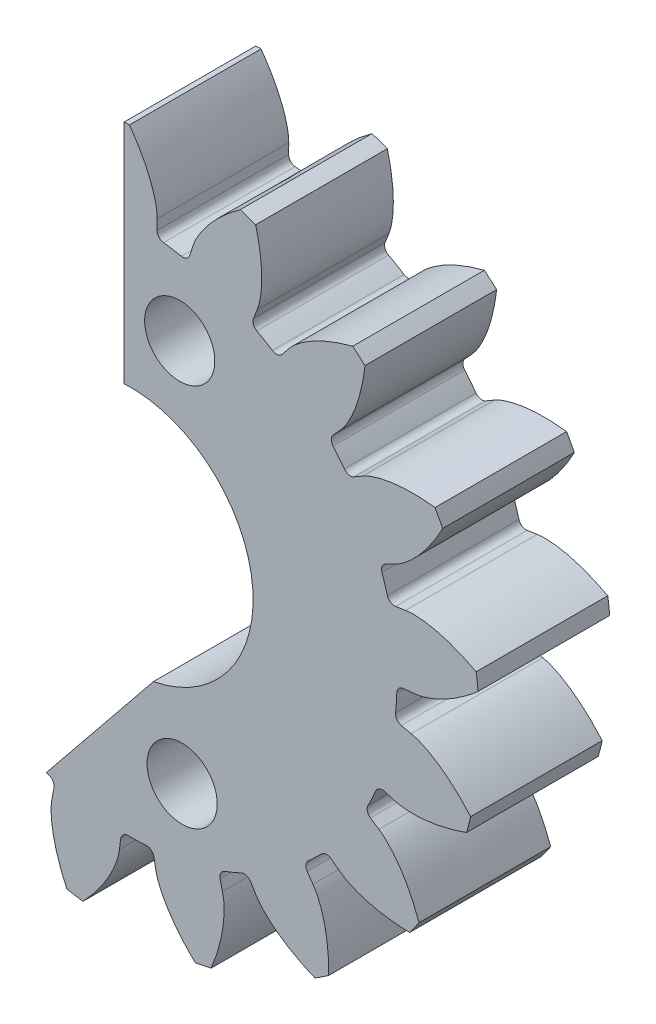
from build123d import *

# Parameters (mm, degrees)
SKETCH1_R                                           = 1.5
BOSS_EXTRUDE1_DEPTH                                 = 4.5
CUT_EXTRUDE1_DEPTH                                  = 18.474286306
CSK_FOR_M2_COUNTERSUNK_FLAT_HEAD_SCREW1_D           = 2.4
CSK_FOR_M2_COUNTERSUNK_FLAT_HEAD_SCREW1_DEPTH       = 10
CSK_FOR_M2_COUNTERSUNK_FLAT_HEAD_SCREW1_CSINK_D     = 4.4
CSK_FOR_M2_COUNTERSUNK_FLAT_HEAD_SCREW1_CSINK_ANGLE = 90
CSK_FOR_M2_COUNTERSUNK_FLAT_HEAD_SCREW1_TIP         = 0.721032743


with BuildPart() as part:
    # Sketch1 → Boss-Extrude1 (new body)
    with BuildSketch(Plane.XY):
        with BuildLine():
            Line((2.142690816, 9.446385822), (2.036760212, 9.116523343))
            ThreePointArc((2.036760212, 9.116523343), (1.925215556, 8.976884922), (1.749077663, 8.946610489))
            ThreePointArc((1.749077663, 8.946610489), (1.443445404, 9.000976463), (1.136139278, 9.044904613))
            ThreePointArc((1.136139278, 9.044904613), (0.978300237, 9.128737399), (0.916012393, 9.296252542))
            Line((0.916012393, 9.296252542), (0.918538131, 9.642697586))
            add(Edge.make_bspline(
                [(0.918538131, 9.642697586), (0.920074647, 9.853455045), (0.756738592, 10.686258414), (0.336577813, 11.434986659), (-0.030409782, 11.94504001)],
                knots=[0, 0, 0, 0, 0.250058326, 1, 1, 1, 1], degree=3))
            ThreePointArc((-0.030409782, 11.94504001), (-0.308005832, 11.941107068), (-0.585435504, 11.93072382))
            add(Edge.make_bspline(
                [(-0.585435504, 11.93072382), (-0.924729077, 11.407724954), (-1.308534817, 10.639195503), (-1.429406641, 9.798416791), (-1.414428472, 9.582521648)],
                knots=[-0.008484668, -0.008484668, -0.008484668, -0.008484668, 0.741457006, 1, 1, 1, 1], degree=3))
            Line((-1.414428472, 9.582521648), (-1.394045746, 9.236667499))
            ThreePointArc((-1.394045746, 9.236667499), (-1.447614825, 9.066163972), (-1.600922132, 8.974305558))
            ThreePointArc((-1.600922132, 8.974305558), (-1.905554981, 8.914593212), (-2.207978087, 8.844543215))
            ThreePointArc((-2.207978087, 8.844543215), (-2.385442505, 8.865696922), (-2.50403764, 8.999399176))
            Line((-2.50403764, 8.999399176), (-2.626832843, 9.32336196))
            add(Edge.make_bspline(
                [(-2.626832843, 9.32336196), (-2.701534461, 9.520442492), (-3.154684073, 10.238004717), (-3.81694417, 10.784393433), (-4.343402434, 11.127432808)],
                knots=[0, 0, 0, 0, 0.250058326, 1, 1, 1, 1], degree=3))
            ThreePointArc((-4.343402434, 11.127432808), (-4.600832298, 11.023486189), (-4.855776901, 10.913584942))
            add(Edge.make_bspline(
                [(-4.855776901, 10.913584942), (-4.983229754, 10.303336047), (-5.063493088, 9.448057053), (-4.872478404, 8.620390313), (-4.780521357, 8.424484826)],
                knots=[-0.008484668, -0.008484668, -0.008484668, -0.008484668, 0.741457006, 1, 1, 1, 1], degree=3))
            Line((-4.780521357, 8.424484826), (-4.636578102, 8.109348527))
            ThreePointArc((-4.636578102, 8.109348527), (-4.624936802, 7.93100734), (-4.734708522, 7.789970933))
            ThreePointArc((-4.734708522, 7.789970933), (-4.997199607, 7.62424475), (-5.253895777, 7.449677247))
            ThreePointArc((-5.253895777, 7.449677247), (-5.427018018, 7.405294949), (-5.585903513, 7.487127083))
            Line((-5.585903513, 7.487127083), (-5.817435487, 7.74485464))
            add(Edge.make_bspline(
                [(-5.817435487, 7.74485464), (-5.95828637, 7.901641426), (-6.640049173, 8.407051753), (-7.454966693, 8.677308116), (-8.069794519, 8.807004146)],
                knots=[0, 0, 0, 0, 0.250058326, 1, 1, 1, 1], degree=3))
            ThreePointArc((-8.069794519, 8.807004146), (-8.272290869, 8.617082417), (-8.470318721, 8.422505943))
            add(Edge.make_bspline(
                [(-8.470318721, 8.422505943), (-8.368717639, 7.807424515), (-8.13459856, 6.980906144), (-7.65749496, 6.278132356), (-7.500978342, 6.128674647)],
                knots=[-0.008484668, -0.008484668, -0.008484668, -0.008484668, 0.741457006, 1, 1, 1, 1], degree=3))
            Line((-7.500978342, 6.128674647), (-7.252914893, 5.886817101))
            ThreePointArc((-7.252914893, 5.886817101), (-7.177635437, 5.724724219), (-7.22904629, 5.553557567))
            ThreePointArc((-7.22904629, 5.553557567), (-7.413944735, 5.304199787), (-7.59024573, 5.048691086))
            ThreePointArc((-7.59024573, 5.048691086), (-7.735644677, 4.944766859), (-7.913362165, 4.963676991))
            Line((-7.913362165, 4.963676991), (-8.222361232, 5.120361784))
            add(Edge.make_bspline(
                [(-8.222361232, 5.120361784), (-8.410338689, 5.2156799), (-9.228638839, 5.440679864), (-10.086154654, 5.398304255), (-10.706316137, 5.297140773)],
                knots=[0, 0, 0, 0, 0.250058326, 1, 1, 1, 1], degree=3))
            ThreePointArc((-10.706316137, 5.297140773), (-10.826530719, 5.046893916), (-10.940897062, 4.793920846))
            add(Edge.make_bspline(
                [(-10.940897062, 4.793920846), (-10.623963835, 4.25707704), (-10.107081422, 3.570945177), (-9.40832439, 3.087977836), (-9.208386639, 3.005152997)],
                knots=[-0.008484668, -0.008484668, -0.008484668, -0.008484668, 0.741457006, 1, 1, 1, 1], degree=3))
            Line((-9.208386639, 3.005152997), (-8.889705338, 2.869238405))
            ThreePointArc((-8.889705338, 2.869238405), (-8.760954633, 2.745285371), (-8.7470613, 2.567105479))
            ThreePointArc((-8.7470613, 2.567105479), (-8.829395545, 2.267793252), (-8.901490937, 1.965851218))
            ThreePointArc((-8.901490937, 1.965851218), (-8.999529656, 1.816420605), (-9.172077407, 1.769854816))
            Line((-9.172077407, 1.769854816), (-9.516811531, 1.804335697))
            add(Edge.make_bspline(
                [(-9.516811531, 1.804335697), (-9.726528165, 1.825311903), (-10.570849691, 1.739514011), (-11.35515154, 1.390229491), (-11.896890436, 1.071869186)],
                knots=[0, 0, 0, 0, 0.250058326, 1, 1, 1, 1], degree=3))
            ThreePointArc((-11.896890436, 1.071869186), (-11.918587603, 0.795094426), (-11.933846629, 0.517890175))
            add(Edge.make_bspline(
                [(-11.933846629, 0.517890175), (-11.444384845, 0.131787721), (-10.714546932, -0.321291723), (-9.888507478, -0.519225201), (-9.672151294, -0.524231217)],
                knots=[-0.008484668, -0.008484668, -0.008484668, -0.008484668, 0.741457006, 1, 1, 1, 1], degree=3))
            Line((-9.672151294, -0.524231217), (-9.325891817, -0.535846836))
            ThreePointArc((-9.325891817, -0.535846836), (-9.16105836, -0.604919479), (-9.083737211, -0.766048429))
            ThreePointArc((-9.083737211, -0.766048429), (-9.052387561, -1.074891329), (-9.010540469, -1.382487749))
            ThreePointArc((-9.010540469, -1.382487749), (-9.047978288, -1.557243317), (-9.19205277, -1.662996058))
            Line((-9.19205277, -1.662996058), (-9.525963699, -1.755375925))
            add(Edge.make_bspline(
                [(-9.525963699, -1.755375925), (-9.729096116, -1.811574581), (-10.485408718, -2.196582847), (-11.090572289, -2.805603469), (-11.480723759, -3.298164274)],
                knots=[0, 0, 0, 0, 0.250058326, 1, 1, 1, 1], degree=3))
            ThreePointArc((-11.480723759, -3.298164274), (-11.400973189, -3.564086973), (-11.315064081, -3.828084435))
            add(Edge.make_bspline(
                [(-11.315064081, -3.828084435), (-10.719178266, -4.01130026), (-9.874953507, -4.170136395), (-9.033192836, -4.056303998), (-8.829638322, -3.982815101)],
                knots=[-0.008484668, -0.008484668, -0.008484668, -0.008484668, 0.741457006, 1, 1, 1, 1], degree=3))
            Line((-8.829638322, -3.982815101), (-8.50256493, -3.868562992))
            ThreePointArc((-8.50256493, -3.868562992), (-8.323910392, -3.873426601), (-8.193604078, -3.995743252))
            ThreePointArc((-8.193604078, -3.995743252), (-8.052804476, -4.272405879), (-7.902666581, -4.544114086))
            ThreePointArc((-7.902666581, -4.544114086), (-7.874447315, -4.7205929), (-7.970590473, -4.8712501))
            Line((-7.970590473, -4.8712501), (-8.248581684, -5.078014301))
            add(Edge.make_bspline(
                [(-8.248581684, -5.078014301), (-8.417695725, -5.20379788), (-8.983855196, -5.836019021), (-9.328149796, -6.622524135), (-9.514021721, -7.222762373)],
                knots=[0, 0, 0, 0, 0.250058326, 1, 1, 1, 1], degree=3))
            ThreePointArc((-9.514021721, -7.222762373), (-9.34359417, -7.441918676), (-9.16811943, -7.657055029))
            add(Edge.make_bspline(
                [(-9.16811943, -7.657055029), (-8.546287266, -7.612639914), (-7.701692893, -7.45578104), (-6.957895448, -7.045556464), (-6.794633768, -6.903497736)],
                knots=[-0.008484668, -0.008484668, -0.008484668, -0.008484668, 0.741457006, 1, 1, 1, 1], degree=3))
            Line((-6.794633768, -6.903497736), (-6.530919535, -6.678808281))
            ThreePointArc((-6.530919535, -6.678808281), (-6.362572202, -6.618805997), (-6.196879311, -6.685790808))
            ThreePointArc((-6.196879311, -6.685790808), (-5.965645524, -6.892908341), (-5.727493781, -7.092032636))
            ThreePointArc((-5.727493781, -7.092032636), (-5.637428599, -7.246400254), (-5.672655765, -7.421614824))
            Line((-5.672655765, -7.421614824), (-5.857183005, -7.714838707))
            add(Edge.make_bspline(
                [(-5.857183005, -7.714838707), (-5.969438883, -7.893219439), (-6.268982248, -8.687268487), (-6.305908984, -9.545036219), (-6.26239833, -10.171886391)],
                knots=[0, 0, 0, 0, 0.250058326, 1, 1, 1, 1], degree=3))
            ThreePointArc((-6.26239833, -10.171886391), (-6.024310985, -10.314678025), (-5.782969448, -10.451897912))
            add(Edge.make_bspline(
                [(-5.782969448, -10.451897912), (-5.219172814, -10.185850364), (-4.488275976, -9.734481141), (-3.942895724, -9.083267488), (-3.841976273, -8.891824748)],
                knots=[-0.008484668, -0.008484668, -0.008484668, -0.008484668, 0.741457006, 1, 1, 1, 1], degree=3))
            Line((-3.841976273, -8.891824748), (-3.677237268, -8.587043502))
            ThreePointArc((-3.677237268, -8.587043502), (-3.541933379, -8.470278967), (-3.363231656, -8.472885267))
            ThreePointArc((-3.363231656, -8.472885267), (-3.072793087, -8.582485337), (-2.778791209, -8.682132879))
            ThreePointArc((-2.778791209, -8.682132879), (-2.639043912, -8.7935411), (-2.608597463, -8.969649341))
            Line((-2.608597463, -8.969649341), (-2.674739306, -9.309731396))
            add(Edge.make_bspline(
                [(-2.674739306, -9.309731396), (-2.714976241, -9.516617976), (-2.70744851, -10.365254206), (-2.432020221, -11.178438271), (-2.165003344, -11.747240788)],
                knots=[0, 0, 0, 0, 0.250058326, 1, 1, 1, 1], degree=3))
            ThreePointArc((-2.165003344, -11.747240788), (-1.891411218, -11.794382951), (-1.616797397, -11.835154067))
            add(Edge.make_bspline(
                [(-1.616797397, -11.835154067), (-1.187180152, -11.38340528), (-0.668692519, -10.698485624), (-0.395386084, -9.894232906), (-0.370438593, -9.679261556)],
                knots=[-0.008484668, -0.008484668, -0.008484668, -0.008484668, 0.741457006, 1, 1, 1, 1], degree=3))
            Line((-0.370438593, -9.679261556), (-0.326923731, -9.335550916))
            ThreePointArc((-0.326923731, -9.335550916), (-0.242936827, -9.177793828), (-0.075360929, -9.115669622))
            ThreePointArc((-0.075360929, -9.115669622), (0.235057082, -9.112950131), (0.545202514, -9.099662968))
            ThreePointArc((0.545202514, -9.099662968), (0.715758279, -9.153065494), (0.807766381, -9.306283012))
            Line((0.807766381, -9.306283012), (0.868942758, -9.647293274))
            add(Edge.make_bspline(
                [(0.868942758, -9.647293274), (0.906158986, -9.854744521), (1.219741152, -10.643354909), (1.770326349, -11.302130292), (2.22478734, -11.736065222)],
                knots=[0, 0, 0, 0, 0.250058326, 1, 1, 1, 1], degree=3))
            ThreePointArc((2.22478734, -11.736065222), (2.496934113, -11.681191105), (2.767732101, -11.620007083))
            add(Edge.make_bspline(
                [(2.767732101, -11.620007083), (3.005147767, -11.043568236), (3.241201568, -10.217600341), (3.205522637, -9.368927344), (3.151128871, -9.159460457)],
                knots=[-0.008484668, -0.008484668, -0.008484668, -0.008484668, 0.741457006, 1, 1, 1, 1], degree=3))
            Line((3.151128871, -9.159460457), (3.067542667, -8.823240448))
            ThreePointArc((3.067542667, -8.823240448), (3.08886969, -8.645796776), (3.222687709, -8.527332282))
            ThreePointArc((3.222687709, -8.527332282), (3.511161491, -8.412660513), (3.795563616, -8.288233151))
            ThreePointArc((3.795563616, -8.288233151), (3.973893348, -8.276417674), (4.115036899, -8.386051594))
            Line((4.115036899, -8.386051594), (4.295269287, -8.681934737))
            add(Edge.make_bspline(
                [(4.295269287, -8.681934737), (4.40491242, -8.861933212), (4.982198012, -9.484011554), (5.733580536, -9.899406991), (6.314108166, -10.139869016)],
                knots=[0, 0, 0, 0, 0.250058326, 1, 1, 1, 1], degree=3))
            ThreePointArc((6.314108166, -10.139869016), (6.548054657, -9.990389672), (6.778464043, -9.835513755))
            add(Edge.make_bspline(
                [(6.778464043, -9.835513755), (6.791613828, -9.212236107), (6.713353424, -8.356771514), (6.373507764, -7.578296229), (6.247118921, -7.402623469)],
                knots=[-0.008484668, -0.008484668, -0.008484668, -0.008484668, 0.741457006, 1, 1, 1, 1], degree=3))
            Line((6.247118921, -7.402623469), (6.047720431, -7.119302467))
            ThreePointArc((6.047720431, -7.119302467), (6.003507239, -6.946136961), (6.085494515, -6.787331466))
            ThreePointArc((6.085494515, -6.787331466), (6.313064084, -6.576194476), (6.53331282, -6.357431519))
            ThreePointArc((6.53331282, -6.357431519), (6.6953321, -6.281993786), (6.866548882, -6.33323744))
            Line((6.866548882, -6.33323744), (7.141495898, -6.544032806))
            add(Edge.make_bspline(
                [(7.141495898, -6.544032806), (7.308758024, -6.672268717), (8.071781424, -7.043799887), (8.9224829, -7.159713921), (9.550673697, -7.174227313)],
                knots=[0, 0, 0, 0, 0.250058326, 1, 1, 1, 1], degree=3))
            ThreePointArc((9.550673697, -7.174227313), (9.714824136, -6.950330756), (9.873726855, -6.722679793))
            add(Edge.make_bspline(
                [(9.873726855, -6.722679793), (9.660834808, -6.136740445), (9.278829699, -5.367314387), (8.68071535, -4.764174216), (8.499400943, -4.646021162)],
                knots=[-0.008484668, -0.008484668, -0.008484668, -0.008484668, 0.741457006, 1, 1, 1, 1], degree=3))
            Line((8.499400943, -4.646021162), (8.211120038, -4.453863238))
            ThreePointArc((8.211120038, -4.453863238), (8.107337868, -4.30836286), (8.126421565, -4.130663926))
            ThreePointArc((8.126421565, -4.130663926), (8.262352391, -3.851576936), (8.388701925, -3.568023533))
            ThreePointArc((8.388701925, -3.568023533), (8.512529152, -3.439151827), (8.69069539, -3.425084476))
            Line((8.69069539, -3.425084476), (9.023223916, -3.522322983))
            add(Edge.make_bspline(
                [(9.023223916, -3.522322983), (9.225515358, -3.58147736), (10.071226027, -3.652284013), (10.906354508, -3.453061812), (11.497367823, -3.239666457)],
                knots=[0, 0, 0, 0, 0.250058326, 1, 1, 1, 1], degree=3))
            ThreePointArc((11.497367823, -3.239666457), (11.569552783, -2.971591157), (11.635488142, -2.701910674))
            add(Edge.make_bspline(
                [(11.635488142, -2.701910674), (11.225306515, -2.232443981), (10.591148608, -1.652971712), (9.815544227, -1.306624075), (9.603791772, -1.261947952)],
                knots=[-0.008484668, -0.008484668, -0.008484668, -0.008484668, 0.741457006, 1, 1, 1, 1], degree=3))
            Line((9.603791772, -1.261947952), (9.265562385, -1.186905099))
            ThreePointArc((9.265562385, -1.186905099), (9.116227595, -1.088720481), (9.069830353, -0.916127333))
            ThreePointArc((9.069830353, -0.916127333), (9.095764224, -0.606782588), (9.111150352, -0.296734198))
            ThreePointArc((9.111150352, -0.296734198), (9.180061972, -0.131833357), (9.341115328, -0.054354874))
            Line((9.341115328, -0.054354874), (9.686315544, -0.024903923))
            add(Edge.make_bspline(
                [(9.686315544, -0.024903923), (9.896315722, -0.006987639), (10.710495748, 0.232493054), (11.417262505, 0.719945428), (11.891278715, 1.132429305)],
                knots=[0, 0, 0, 0, 0.250058326, 1, 1, 1, 1], degree=3))
            ThreePointArc((11.891278715, 1.132429305), (11.861749218, 1.408478293), (11.825812282, 1.683766454))
            add(Edge.make_bspline(
                [(11.825812282, 1.683766454), (11.273738375, 1.973356413), (10.47307421, 2.284613953), (9.624729466, 2.327392886), (9.411137305, 2.292558321)],
                knots=[-0.008484668, -0.008484668, -0.008484668, -0.008484668, 0.741457006, 1, 1, 1, 1], degree=3))
            Line((9.411137305, 2.292558321), (9.068639189, 2.24035115))
            ThreePointArc((9.068639189, 2.24035115), (8.89392027, 2.277959631), (8.788308294, 2.422137332))
            ThreePointArc((8.788308294, 2.422137332), (8.700742697, 2.719961111), (8.603087437, 3.014630735))
            ThreePointArc((8.603087437, 3.014630735), (8.607776555, 3.193289938), (8.72996588, 3.323715655))
            Line((8.72996588, 3.323715655), (9.041216585, 3.47587855))
            add(Edge.make_bspline(
                [(9.041216585, 3.47587855), (9.23056381, 3.568445801), (9.90325367, 4.085870646), (10.386205936, 4.795720049), (10.679206525, 5.351584215)],
                knots=[0, 0, 0, 0, 0.250058326, 1, 1, 1, 1], degree=3))
            ThreePointArc((10.679206525, 5.351584215), (10.551950692, 5.598324945), (10.418994944, 5.842041592))
            add(Edge.make_bspline(
                [(10.418994944, 5.842041592), (9.799589398, 5.912644088), (8.940553107, 5.913649844), (8.134041659, 5.647082543), (7.947456596, 5.537441889)],
                knots=[-0.008484668, -0.008484668, -0.008484668, -0.008484668, 0.741457006, 1, 1, 1, 1], degree=3))
            Line((7.947456596, 5.537441889), (7.64694602, 5.365035562))
            ThreePointArc((7.64694602, 5.365035562), (7.470439729, 5.336988673), (7.319876502, 5.433278929))
            ThreePointArc((7.319876502, 5.433278929), (7.130637656, 5.67935899), (6.933129893, 5.918853082))
            ThreePointArc((6.933129893, 5.918853082), (6.872963217, 6.087141733), (6.939786166, 6.252899967))
            Line((6.939786166, 6.252899967), (7.175051226, 6.507224364))
            add(Edge.make_bspline(
                [(7.175051226, 6.507224364), (7.318173108, 6.661940862), (7.758522308, 7.387428767), (7.952434703, 8.223806103), (8.024848318, 8.847978022)],
                knots=[0, 0, 0, 0, 0.250058326, 1, 1, 1, 1], degree=3))
            ThreePointArc((8.024848318, 8.847978022), (7.817052756, 9.032086792), (7.605034605, 9.211316641))
            add(Edge.make_bspline(
                [(7.605034605, 9.211316641), (7.001951571, 9.053396417), (6.200560765, 8.744014555), (5.544806453, 8.20410241), (5.410427836, 8.034463247)],
                knots=[-0.008484668, -0.008484668, -0.008484668, -0.008484668, 0.741457006, 1, 1, 1, 1], degree=3))
            Line((5.410427836, 8.034463247), (5.192490418, 7.765142193))
            ThreePointArc((5.192490418, 7.765142193), (5.038034908, 7.675227821), (4.862854828, 7.710626099))
            ThreePointArc((4.862854828, 7.710626099), (4.597500488, 7.871727967), (4.326814738, 8.023701524))
            ThreePointArc((4.326814738, 8.023701524), (4.209918111, 8.158891306), (4.212349875, 8.33759549))
            Line((4.212349875, 8.33759549), (4.339855442, 8.65973347))
            add(Edge.make_bspline(
                [(4.339855442, 8.65973347), (4.417422576, 8.855703895), (4.565959517, 9.691273698), (4.444643097, 10.541221574), (4.286689878, 11.149403369)],
                knots=[0, 0, 0, 0, 0.250058326, 1, 1, 1, 1], degree=3))
            ThreePointArc((4.286689878, 11.149403369), (4.026418528, 11.246015269), (3.763972202, 11.336552336))
            add(Edge.make_bspline(
                [(3.763972202, 11.336552336), (3.258661385, 10.971437393), (2.623148333, 10.393451648), (2.206714411, 9.653112786), (2.142690816, 9.446385822)],
                knots=[-0.008484668, -0.008484668, -0.008484668, -0.008484668, 0.741457006, 1, 1, 1, 1], degree=3))
        make_face()
        Circle(SKETCH1_R, mode=Mode.SUBTRACT)
    extrude(amount=BOSS_EXTRUDE1_DEPTH)

    # Sketch4 → Cut-Extrude1 (cut, through all)
    with BuildSketch(Plane(origin=(0, 0, 0), x_dir=(-1, 0, 0), z_dir=(0, 0, -1))):
        with BuildLine():
            Line((12.86321323, 15.189801976), (0.209946094, 15.189801976))
            Line((0.209946094, 15.189801976), (0.209946094, 4.194749413))
            ThreePointArc((0.209946094, 4.194749413), (-4.169900225, 0.501928397), (-0.791467324, -4.12475205))
            Line((-0.791467324, -4.12475205), (2.872793087, -8.653266145))
            Line((2.872793087, -8.653266145), (2.872793087, -14.49172888))
            Line((2.872793087, -14.49172888), (12.86321323, -14.49172888))
            Line((12.86321323, -14.49172888), (12.86321323, 15.189801976))
        make_face()
    extrude(amount=-CUT_EXTRUDE1_DEPTH, mode=Mode.SUBTRACT)

    # CSK for M2 Countersunk Flat Head Screw1
    with Locations(Plane(origin=(0, 0, 0), x_dir=(1, 0, 0), z_dir=(0, 0, -1))):
        with Locations((1.690053906, -6.412399978), (1.772781001, 6.658395059)):
            CounterSinkHole(CSK_FOR_M2_COUNTERSUNK_FLAT_HEAD_SCREW1_D / 2, CSK_FOR_M2_COUNTERSUNK_FLAT_HEAD_SCREW1_CSINK_D / 2, depth=CSK_FOR_M2_COUNTERSUNK_FLAT_HEAD_SCREW1_DEPTH, counter_sink_angle=CSK_FOR_M2_COUNTERSUNK_FLAT_HEAD_SCREW1_CSINK_ANGLE)
            with Locations((0, 0, -(CSK_FOR_M2_COUNTERSUNK_FLAT_HEAD_SCREW1_DEPTH + CSK_FOR_M2_COUNTERSUNK_FLAT_HEAD_SCREW1_TIP / 2))):  # 118° drill point
                Cone(0, CSK_FOR_M2_COUNTERSUNK_FLAT_HEAD_SCREW1_D / 2, CSK_FOR_M2_COUNTERSUNK_FLAT_HEAD_SCREW1_TIP, mode=Mode.SUBTRACT)


solid = part.part
